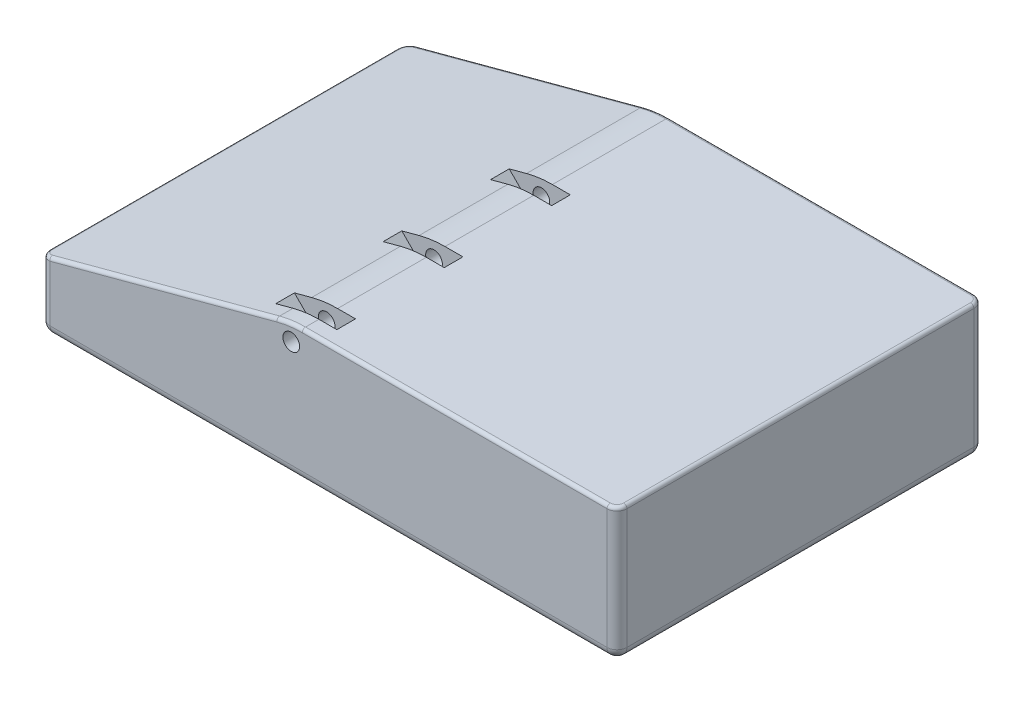
from build123d import *

# Parameters (mm, degrees)
BOSS_EXTRUDE1_DEPTH = 110
SHELL1_T            = -5
BOSS_EXTRUDE2_REACH = 181.428
SKETCH3_R           = 2.5
CUT_EXTRUDE8_START  = -35
SKETCH3_4_R         = 2.5
CUT_EXTRUDE8_DEPTH  = 5.6
SKETCH3_5_R         = 2.5
CUT_EXTRUDE9_DEPTH  = 180.427762875
LPATTERN1_COUNT     = 3
LPATTERN1_PITCH     = 32.2
FILLET1_R           = 3
FILLET2_R           = 1
FILLET3_R           = 30


with BuildPart() as part:
    # Sketch1 → Boss-Extrude1 (new body)
    with BuildSketch(Plane.XY):
        Polygon((-140.305001839, -20.219509128), (32.648970599, -20.219509128), (32.648970599, 19.780490872), (-65.663985687, 19.780490872), (-140.305001839, -0.219509128), align=None)
    extrude(amount=BOSS_EXTRUDE1_DEPTH)

    # Shell1
    shell1_openings = [part.faces().sort_by_distance(p)[0] for p in [
        (-53.82801562, -20.219509128, 55),
    ]]
    offset(amount=SHELL1_T, openings=shell1_openings, kind=Kind.INTERSECTION)

    # Sketch3 → Boss-Extrude2 (add, up to next)
    with BuildSketch(Plane(origin=(0, 0, 0), x_dir=(-1, 0, 0), z_dir=(0, 0, -1)), mode=Mode.PRIVATE) as boss_extrude2_sk1:
        with BuildLine():
            Line((56.345469162, 19.780490872), (60.675596181, 12.280490872))
            ThreePointArc((60.675596181, 12.280490872), (64.353092238, 9.823266565), (68.541257105, 11.244956966))
            Line((68.541257105, 11.244956966), (74.664981462, 17.368681323))
            Line((74.664981462, 17.368681323), (65.663985687, 19.780490872))
            Line((65.663985687, 19.780490872), (56.345469162, 19.780490872))
        make_face()
        with Locations((65.0057232, 14.780490872)):
            Circle(SKETCH3_R, mode=Mode.SUBTRACT)
    boss_extrude2_tool1 = extrude(boss_extrude2_sk1.sketch, amount=-BOSS_EXTRUDE2_REACH, mode=Mode.PRIVATE) - part.part
    add(boss_extrude2_tool1.solids().sort_by_distance((-58.691282, 16.134847, 0))[0])

    # Sketch3<4> → Cut-Extrude8 (cut)
    # profile 1 of 2: a face of its own
    with BuildSketch(Plane(origin=(0, 0, 0), x_dir=(-1, 0, 0), z_dir=(0, 0, -1)).offset(CUT_EXTRUDE8_START)):
        with BuildLine():
            Line((56.345469162, 19.780490872), (60.675596181, 12.280490872))
            ThreePointArc((60.675596181, 12.280490872), (64.353092238, 9.823266565), (68.541257105, 11.244956966))
            Line((68.541257105, 11.244956966), (74.664981462, 17.368681323))
            Line((74.664981462, 17.368681323), (65.663985687, 19.780490872))
            Line((65.663985687, 19.780490872), (56.345469162, 19.780490872))
        make_face()
        with Locations((65.0057232, 14.780490872)):
            Circle(SKETCH3_4_R, mode=Mode.SUBTRACT)
    # profile 2 of 2: a face of its own
    with BuildSketch(Plane(origin=(0, 0, 0), x_dir=(-1, 0, 0), z_dir=(0, 0, -1)).offset(CUT_EXTRUDE8_START)):
        with Locations((65.0057232, 14.780490872)):
            Circle(SKETCH3_4_R)
    cut_extrude8 = extrude(amount=-CUT_EXTRUDE8_DEPTH, mode=Mode.SUBTRACT)

    # Sketch3<5> → Cut-Extrude9 (cut, through all)
    with BuildSketch(Plane(origin=(0, 0, 0), x_dir=(-1, 0, 0), z_dir=(0, 0, -1))):
        with Locations((65.0057232, 14.780490872)):
            Circle(SKETCH3_5_R)
    extrude(amount=-CUT_EXTRUDE9_DEPTH, mode=Mode.SUBTRACT)

    # LPattern1: Cut-Extrude8 ×3
    with Locations(*[(0, 0, i * LPATTERN1_PITCH) for i in range(1, LPATTERN1_COUNT)]):
        add(cut_extrude8, mode=Mode.SUBTRACT)

    # Fillet1
    fillet1_edges = [part.edges().sort_by_distance(p)[0] for p in [
        (32.648970599, -0.219509128, 110),
        (-140.305001839, -10.219509128, 110),
        (32.648970599, -0.219509128, 0),
        (-53.82801562, -20.219509128, 0),
        (-140.305001839, -10.219509128, 0),
        (-53.82801562, -20.219509128, 110),
        (32.648970599, -20.219509128, 55),
        (-140.305001839, -20.219509128, 55),
    ]]
    fillet(fillet1_edges, radius=FILLET1_R)

    # Fillet2
    fillet2_edges = [part.edges().sort_by_distance(p)[0] for p in [
        (-101.484493763, 10.182414661, 110),
        (-140.305001839, -0.219509128, 55),
        (-18.007507544, 19.780490872, 110),
        (-139.407865484, 0.020877834, 0.860382163),
        (-139.407865484, 0.020877834, 109.139617837),
        (-18.007507544, 19.780490872, 0),
        (32.648970599, 19.780490872, 55),
        (31.770290943, 19.780490872, 109.121320344),
        (31.770290943, 19.780490872, 0.878679656),
        (-101.484493763, 10.182414661, 0),
    ]]
    fillet(fillet2_edges, radius=FILLET2_R)

    # Fillet3
    # the kernel refuses this fillet: 30 mm, written as the material it takes off along each edge
    with BuildSketch(Plane(origin=(-61.71441076, -10.219509128, 0), x_dir=(-0.25881904510251463, 0.96592582628907, 0), z_dir=(-0.96592582628907, -0.25881904510251463, 0))) as fillet3_piece_1:
        with BuildLine():
            CenterArc((29, -1), 1, 0, 90)
            Line((30, -1), (30, 0))
            Line((30, 0), (29, 0))
        make_face()
    revolve(axis=Axis((-61.71441076, -10.219509128, 0), (0, 0, -1)), revolution_arc=15, mode=Mode.SUBTRACT)
    with BuildSketch(Plane(origin=(-61.71441076, -10.219509128, 110), x_dir=(0, 1, 0), z_dir=(1, 0, 0))) as fillet3_piece_2:
        with BuildLine():
            CenterArc((29, -1), 1, 0, 90)
            Line((30, -1), (30, 0))
            Line((30, 0), (29, 0))
        make_face()
    revolve(axis=Axis((-61.71441076, -10.219509128, 110), (0, 0, 1)), revolution_arc=15, mode=Mode.SUBTRACT)
    with BuildSketch(Plane(origin=(-65.663985687, 19.780490872, 62.926062681), x_dir=(1, 0, 0), z_dir=(0, 0, 1)), Plane(origin=(-65.663985687, 19.780490872, 30.726062681), x_dir=(1, 0, 0), z_dir=(0, 0, 1))) as fillet3_piece_3:
        with BuildLine():
            CenterArc((FILLET3_R * 0.131652497587, -FILLET3_R), FILLET3_R, 90, 15)
            Line((-FILLET3_R * 0.127166547515, -FILLET3_R * 0.0340741737109), (0, 0))
            Line((0, 0), (FILLET3_R * 0.131652497587, 0))
        make_face()
    extrude(amount=46.347874638, mode=Mode.SUBTRACT)
    with BuildSketch(Plane(origin=(-65.663985687, 19.780490872, 95.126062681), x_dir=(1, 0, 0), z_dir=(0, 0, 1))) as fillet3_piece_4:
        with BuildLine():
            CenterArc((FILLET3_R * 0.131652497587, -FILLET3_R), FILLET3_R, 90, 15)
            Line((-FILLET3_R * 0.127166547515, -FILLET3_R * 0.0340741737109), (0, 0))
            Line((0, 0), (FILLET3_R * 0.131652497587, 0))
        make_face()
    extrude(amount=14.873937319, mode=Mode.SUBTRACT)
    with BuildSketch(Plane(origin=(-65.663985687, 19.780490872, 0), x_dir=(1, 0, 0), z_dir=(0, 0, 1))) as fillet3_piece_5:
        with BuildLine():
            CenterArc((FILLET3_R * 0.131652497587, -FILLET3_R), FILLET3_R, 90, 15)
            Line((-FILLET3_R * 0.127166547515, -FILLET3_R * 0.0340741737109), (0, 0))
            Line((0, 0), (FILLET3_R * 0.131652497587, 0))
        make_face()
    extrude(amount=44.873937319, mode=Mode.SUBTRACT)


solid = part.part
